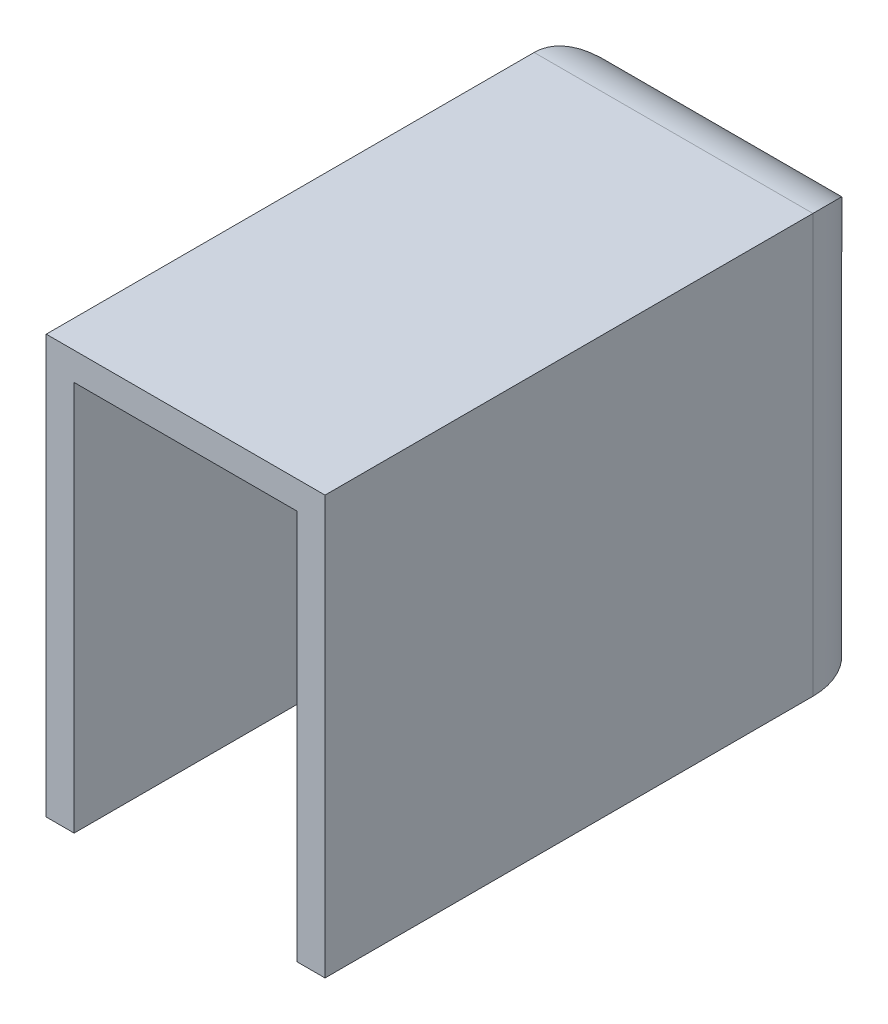
from build123d import *

# Parameters (mm, degrees)
SZKIC1_W                    = 20
SZKIC1_H                    = 30
DODANIE_WYCI_GNI_CIE1_DEPTH = 40
SKORUPA3_T                  = -2
ZAOKR_GLENIE1_R             = 5
SZKIC2_W                    = 12
SZKIC2_H                    = 2
DODANIE_WYCI_GNI_CIE2_DEPTH = 2.5
WYTNIJ_WYCI_GNI_CIE2_DEPTH  = 8


with BuildPart() as part:
    # Szkic1 → Dodanie-wyciągnięcie1 (new body)
    with BuildSketch(Plane.XY):
        Rectangle(SZKIC1_W, SZKIC1_H)
    extrude(amount=DODANIE_WYCI_GNI_CIE1_DEPTH)

    # Skorupa3
    skorupa3_openings = [part.faces().sort_by_distance(p)[0] for p in [
        (0, 0, 40),
        (0, -15, 20),
    ]]
    offset(amount=SKORUPA3_T, openings=skorupa3_openings, kind=Kind.INTERSECTION)

    # Zaokrąglenie1
    zaokr_glenie1_edges = [part.edges().sort_by_distance(p)[0] for p in [
        (-10, 0, 0),
        (0, 15, 0),
        (10, 0, 0),
    ]]
    fillet(zaokr_glenie1_edges, radius=ZAOKR_GLENIE1_R)

    # Szkic2 → Dodanie-wyciągnięcie2 (add)
    with BuildSketch(Plane.XY.offset(2)):
        with Locations((0, -11)):
            Rectangle(SZKIC2_W, SZKIC2_H)
    extrude(amount=DODANIE_WYCI_GNI_CIE2_DEPTH)

    # Szkic3 → Wytnij-wyciągnięcie2 (cut)
    with BuildSketch(Plane.ZY.offset(10)):
        with BuildLine():
            Line((20.641025641, -4.556176111), (19.807692308, -4.556176111))
            Line((19.807692308, -4.556176111), (19.807692308, -2.376688932))
            Line((19.807692308, -2.376688932), (21.816907051, -2.376688932))
            add(Edge.make_bspline(
                [(21.816907051, -2.376688932), (21.841607172, -2.404119009), (21.892099215, -2.460191638), (21.963305627, -2.551680459), (22.031286295, -2.652401033), (22.097418, -2.761744483), (22.161168479, -2.879937096), (22.223425613, -3.006507457), (22.283580548, -3.141689093), (22.358936903, -3.33285569), (22.440930845, -3.578926288), (22.512227242, -3.879752514), (22.555956136, -4.182958471), (22.561388856, -4.385762512), (22.564102564, -4.487065534)],
                knots=[0, 0, 0, 0, 0.581799769, 1.189316438, 1.825828404, 2.496525428, 3.203088405, 3.942228803, 4.719818701, 5.534979611, 7.181138583, 8.803804008, 10.403462225, 12, 12, 12, 12], degree=3))
            add(Edge.make_bspline(
                [(22.564102564, -4.487065534), (22.56313771, -4.550526088), (22.561235696, -4.675625714), (22.546264428, -4.860344064), (22.519798815, -5.038440708), (22.485242787, -5.21097809), (22.438993022, -5.376852395), (22.383130286, -5.537114246), (22.315284051, -5.690166327), (22.240013459, -5.837827837), (22.153109515, -5.976660643), (22.05975943, -6.108869096), (21.954712408, -6.229820054), (21.842084928, -6.342828261), (21.720739966, -6.446770091), (21.591245422, -6.543031613), (21.451223299, -6.627405043), (21.304430638, -6.704430963), (21.151576146, -6.772506785), (20.993907549, -6.830037408), (20.8336337, -6.88045066), (20.670213558, -6.921890966), (20.503110001, -6.952325327), (20.333097773, -6.975984805), (20.159114201, -6.98869215), (20.042085267, -6.990938761), (19.982972756, -6.992073547)],
                knots=[0, 0, 0, 0, 1.124870323, 2.21745397, 3.282093991, 4.315108093, 5.334572204, 6.332243885, 7.320762988, 8.300151271, 9.26752074, 10.221766301, 11.166049239, 12.10346349, 13.047746428, 13.995897688, 14.960166402, 15.942286796, 16.933194762, 17.923749186, 18.9158406, 19.910576421, 20.910001974, 21.925283033, 22.952039271, 24, 24, 24, 24], degree=3))
            add(Edge.make_bspline(
                [(19.982972756, -6.992073547), (19.919171524, -6.991153319), (19.79339172, -6.989339153), (19.607491117, -6.973701447), (19.427036219, -6.949423047), (19.252363356, -6.912587996), (19.082627667, -6.867837664), (18.91776439, -6.812893148), (18.758879442, -6.746395566), (18.605243792, -6.671605309), (18.458930445, -6.586755203), (18.321547085, -6.491279103), (18.19257883, -6.386558691), (18.07234594, -6.272679475), (17.961824026, -6.148502583), (17.859692048, -6.015822665), (17.764266706, -5.874862269), (17.710458971, -5.773976768), (17.683293269, -5.723043098)],
                knots=[0, 0, 0, 0, 1.10495205, 2.178338036, 3.229289647, 4.256861867, 5.268261169, 6.268605141, 7.264190331, 8.24959529, 9.226598297, 10.190731044, 11.144505659, 12.1017105, 13.055993425, 14.020715697, 15.000726451, 16, 16, 16, 16], degree=3))
            add(Edge.make_bspline(
                [(17.683293269, -5.723043098), (17.663222564, -5.682621747), (17.622457313, -5.600522664), (17.573786469, -5.469902682), (17.529500728, -5.333292269), (17.496458133, -5.188628908), (17.469311089, -5.036894978), (17.449052264, -4.878157722), (17.438413574, -4.711906463), (17.436748742, -4.598924876), (17.435897436, -4.541152073)],
                knots=[0, 0, 0, 0, 0.887969848, 1.803539625, 2.741143579, 3.713741423, 4.722068772, 5.775476617, 6.8624965, 8, 8, 8, 8], degree=3))
            add(Edge.make_bspline(
                [(17.435897436, -4.541152073), (17.437006934, -4.466664573), (17.439164703, -4.321800159), (17.457144472, -4.110598688), (17.488132013, -3.911830505), (17.53081029, -3.725218809), (17.585683225, -3.551165622), (17.653142873, -3.389970572), (17.731831627, -3.240644282), (17.824903112, -3.105349561), (17.927525315, -2.981336726), (18.039823064, -2.868929384), (18.161962694, -2.768082291), (18.293329632, -2.678728729), (18.434466873, -2.601571971), (18.584087212, -2.535231895), (18.74332652, -2.480625981), (18.853915398, -2.454236154), (18.91025641, -2.440791496)],
                knots=[0, 0, 0, 0, 1.271135529, 2.472123572, 3.614091059, 4.701890498, 5.736279567, 6.724681829, 7.680621489, 8.611506429, 9.52200816, 10.424540711, 11.318996785, 12.221421405, 13.131851814, 14.060431888, 15.011860567, 16, 16, 16, 16], degree=3))
            Line((18.91025641, -2.440791496), (19.102564103, -3.402329957))
            add(Edge.make_bspline(
                [(19.102564103, -3.402329957), (19.071011611, -3.411851013), (19.008759135, -3.430635878), (18.919399809, -3.467051569), (18.835396133, -3.50899445), (18.756140078, -3.55656513), (18.682119581, -3.610242846), (18.614133102, -3.671324446), (18.549079504, -3.735967537), (18.491486815, -3.808393914), (18.439567267, -3.885594645), (18.392749267, -3.966699841), (18.354781175, -4.053542135), (18.324231714, -4.144905089), (18.29828716, -4.240342158), (18.282331161, -4.341098834), (18.270297253, -4.446043636), (18.269590072, -4.517743762), (18.269230769, -4.554172906)],
                knots=[0, 0, 0, 0, 1.027736275, 2.027704492, 3.005900071, 3.954421694, 4.908588141, 5.853155543, 6.803277083, 7.766271258, 8.734041521, 9.704274878, 10.683578894, 11.68490234, 12.708089448, 13.76461009, 14.864251086, 16, 16, 16, 16], degree=3))
            add(Edge.make_bspline(
                [(18.269230769, -4.554172906), (18.270701837, -4.60930969), (18.27357275, -4.716913823), (18.292306078, -4.874001517), (18.325634386, -5.022199345), (18.371604432, -5.161894835), (18.430610205, -5.29334409), (18.504852497, -5.414770823), (18.589938279, -5.529198487), (18.689800066, -5.633370871), (18.801773663, -5.727843387), (18.927194676, -5.809626249), (19.065657691, -5.877710131), (19.216467446, -5.933474712), (19.379630228, -5.977875216), (19.555723638, -6.007995956), (19.744477527, -6.027676299), (19.874746598, -6.0295626), (19.941907051, -6.030535086)],
                knots=[0, 0, 0, 0, 1.043810997, 2.037086103, 2.989314757, 3.91471467, 4.817033861, 5.710208705, 6.603920097, 7.511448416, 8.435617211, 9.371747005, 10.338444094, 11.350425613, 12.411431869, 13.5347293, 14.729025275, 16, 16, 16, 16], degree=3))
            add(Edge.make_bspline(
                [(19.941907051, -6.030535086), (20.01406657, -6.029521504), (20.154312808, -6.027551549), (20.357516052, -6.008379934), (20.546853065, -5.97687885), (20.722011622, -5.931576215), (20.883580614, -5.875068862), (21.031771522, -5.805712265), (21.165237941, -5.722613054), (21.284453118, -5.626530518), (21.38896132, -5.52025445), (21.481779425, -5.406800282), (21.557392886, -5.283433634), (21.621435605, -5.153653794), (21.670552222, -5.015463902), (21.705427867, -4.869419783), (21.726970171, -4.715404617), (21.729485033, -4.610000168), (21.730769231, -4.556176111)],
                knots=[0, 0, 0, 0, 1.318197387, 2.561993571, 3.725366402, 4.821761769, 5.86366509, 6.848782561, 7.805166949, 8.729314018, 9.639502935, 10.5245885, 11.401436603, 12.277223017, 13.164827806, 14.074791815, 15.01690569, 16, 16, 16, 16], degree=3))
            add(Edge.make_bspline(
                [(21.730769231, -4.556176111), (21.729226261, -4.501665697), (21.726125562, -4.392123401), (21.700729377, -4.22784814), (21.661073173, -4.063443421), (21.60432143, -3.90169462), (21.53816717, -3.745203414), (21.463920899, -3.598190563), (21.384715103, -3.461358354), (21.323239584, -3.378763109), (21.29306891, -3.338227393)],
                knots=[0, 0, 0, 0, 0.993986376, 1.997481602, 3.025645471, 4.075393737, 5.120679791, 6.123065364, 7.078846615, 8, 8, 8, 8], degree=3))
            Line((21.29306891, -3.338227393), (20.641025641, -3.338227393))
            Line((20.641025641, -3.338227393), (20.641025641, -4.556176111))
        make_face()
        Polygon((22.5, 0.431003376), (17.5, 0.431003376), (17.5, 4.148952094), (18.333333333, 4.148952094), (18.333333333, 1.392541837), (19.423076923, 1.392541837), (19.423076923, 3.956644402), (20.256410256, 3.956644402), (20.256410256, 1.392541837), (21.666666667, 1.392541837), (21.666666667, 4.213054658), (22.5, 4.213054658), align=None)
    extrude(amount=-WYTNIJ_WYCI_GNI_CIE2_DEPTH, mode=Mode.SUBTRACT)


solid = part.part
